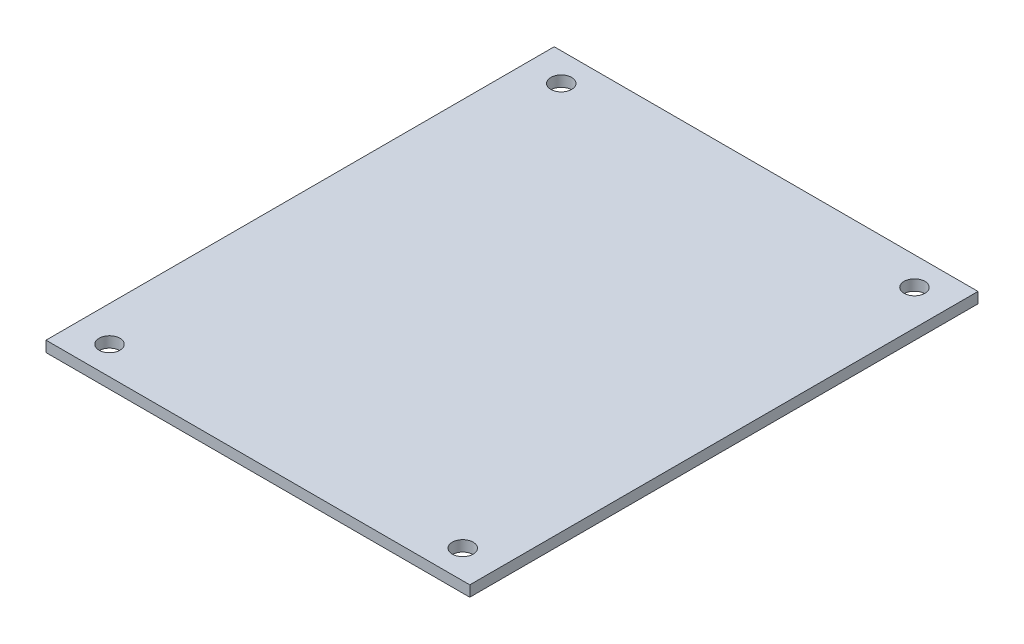
from build123d import *

# Parameters (mm, degrees)
SZKIC1_W                    = 61
SZKIC1_H                    = 73.152
SZKIC1_R                    = 1.5
DODANIE_WYCI_GNI_CIE1_DEPTH = 1.55


with BuildPart() as part:
    # Szkic1 → Dodanie-wyciągnięcie1 (new body)
    with BuildSketch(Plane(origin=(0, 0, 0), x_dir=(1, 0, 0), z_dir=(0, 1, 0))):
        Rectangle(SZKIC1_W, SZKIC1_H)
        with Locations((-25.42, 32.512)):
            Circle(SZKIC1_R, mode=Mode.SUBTRACT)
        with Locations((25.42, 32.512)):
            Circle(SZKIC1_R, mode=Mode.SUBTRACT)
        with Locations((-25.42, -32.512)):
            Circle(SZKIC1_R, mode=Mode.SUBTRACT)
        with Locations((25.42, -32.512)):
            Circle(SZKIC1_R, mode=Mode.SUBTRACT)
    extrude(amount=DODANIE_WYCI_GNI_CIE1_DEPTH)


solid = part.part
